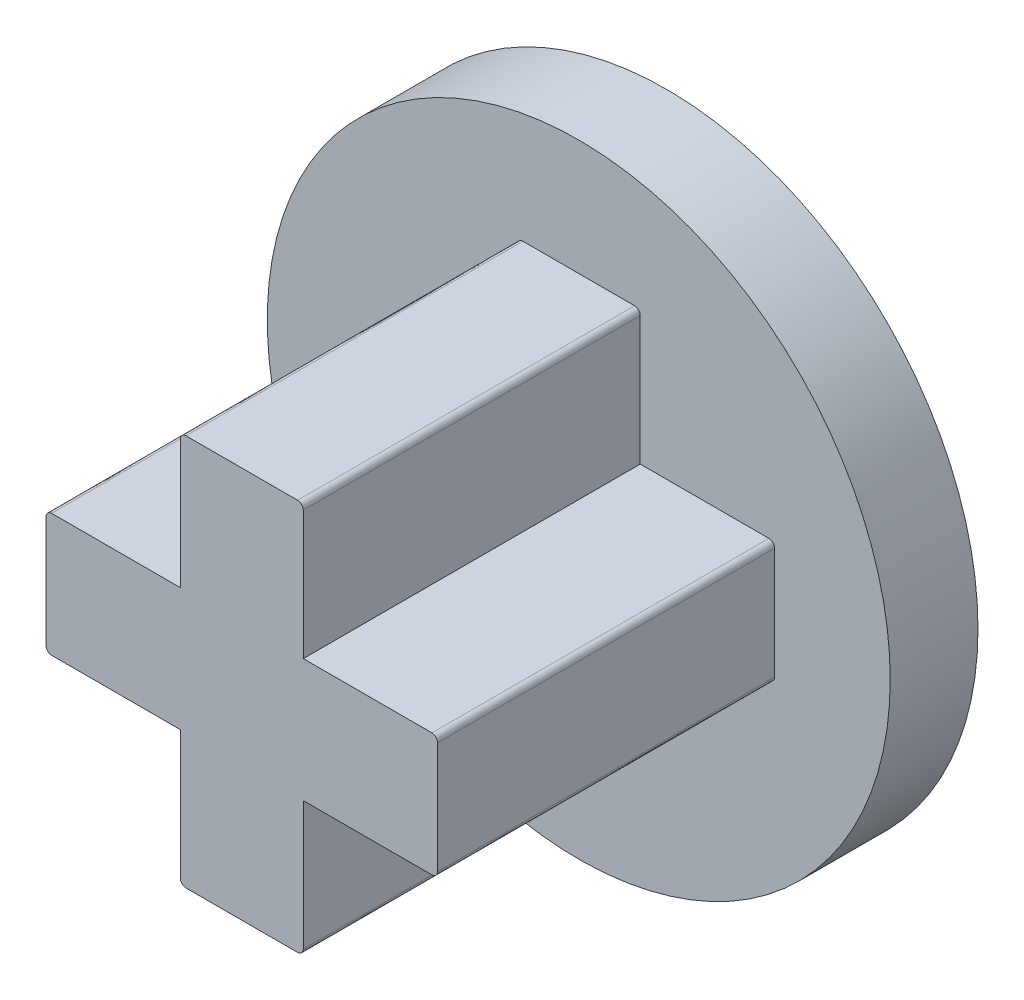
from build123d import *

# Parameters (mm, degrees)
SKETCH1_R           = 11
BOSS_EXTRUDE1_DEPTH = 15
CUT_EXTRUDE1_START  = -11.9
SKETCH2_R           = 11
CUT_EXTRUDE1_DEPTH  = 11.9
FILLET1_SIZE        = 0.2


with BuildPart() as part:
    # Sketch1 → Boss-Extrude1 (new body)
    with BuildSketch(Plane.XY):
        Circle(SKETCH1_R)
    extrude(amount=BOSS_EXTRUDE1_DEPTH)

    # Sketch2 → Cut-Extrude1 (cut)
    with BuildSketch(Plane.XY.offset(15).offset(CUT_EXTRUDE1_START)):
        Circle(SKETCH2_R)
        Polygon((-2.171708245, 2.171708245), (-6.915124735, 2.171708245), (-6.915124735, -2.171708245), (-2.171708245, -2.171708245), (-2.171708245, -6.915124735), (2.171708245, -6.915124735), (2.171708245, -2.171708245), (6.915124735, -2.171708245), (6.915124735, 2.171708245), (2.171708245, 2.171708245), (2.171708245, 6.915124735), (-2.171708245, 6.915124735), align=None, mode=Mode.SUBTRACT)
    extrude(amount=CUT_EXTRUDE1_DEPTH, mode=Mode.SUBTRACT)

    # Fillet1
    # a fillet whose section is not a circle: 0.2 mm, written as the material it takes off along each edge
    with BuildSketch(Plane(origin=(-6.915124735, 2.171708245, 3.1), x_dir=(0, -1, 0), z_dir=(0, 0, 1)), Plane(origin=(-6.915124735, -2.171708245, 3.1), x_dir=(1, 0, 0), z_dir=(0, 0, 1)), Plane(origin=(-2.171708245, -6.915124735, 3.1), x_dir=(1, 0, 0), z_dir=(0, 0, 1)), Plane(origin=(2.171708245, -6.915124735, 3.1), x_dir=(0, 1, 0), z_dir=(0, 0, 1)), Plane(origin=(6.915124735, -2.171708245, 3.1), x_dir=(0, 1, 0), z_dir=(0, 0, 1)), Plane(origin=(6.915124735, 2.171708245, 3.1), x_dir=(-1, 0, 0), z_dir=(0, 0, 1)), Plane(origin=(2.171708245, 6.915124735, 3.1), x_dir=(-1, 0, 0), z_dir=(0, 0, 1)), Plane(origin=(-2.171708245, 6.915124735, 3.1), x_dir=(0, -1, 0), z_dir=(0, 0, 1))) as fillet1_piece_1:
        with BuildLine():
            Bezier((FILLET1_SIZE, 0), (0, 0), (0, FILLET1_SIZE), weights=[1, 0.666666667, 1])
            Line((0, FILLET1_SIZE), (0, 0))
            Line((0, 0), (FILLET1_SIZE, 0))
        make_face()
    extrude(amount=12.4, mode=Mode.SUBTRACT)


solid = part.part
